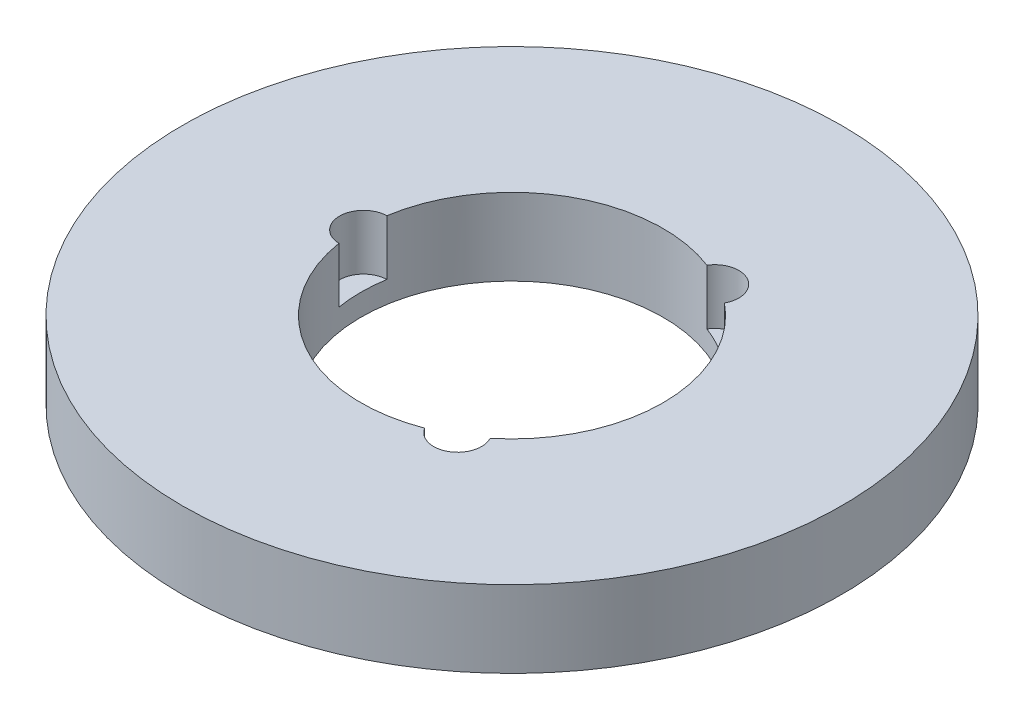
from build123d import *

# Parameters (mm, degrees)
SKETCH1_R           = 60
BOSS_EXTRUDE1_DEPTH = 14
SKETCH2_R           = 27.5
CUT_EXTRUDE1_DEPTH  = 87
SKETCH3_R           = 4.363101274
CUT_EXTRUDE2_DEPTH  = 10.056409431
CIRPATTERN1_COUNT   = 3


with BuildPart() as part:
    # Sketch1 → Boss-Extrude1 (new body)
    with BuildSketch(Plane(origin=(0, 0, 0), x_dir=(1, 0, 0), z_dir=(0, 1, 0))):
        Circle(SKETCH1_R)
    extrude(amount=BOSS_EXTRUDE1_DEPTH)

    # Sketch2 → Cut-Extrude1 (cut, through all)
    with BuildSketch(Plane(origin=(0, 0, 0), x_dir=(1, 0, 0), z_dir=(0, 1, 0))):
        Circle(SKETCH2_R)
    extrude(amount=CUT_EXTRUDE1_DEPTH, mode=Mode.SUBTRACT)

    # Sketch3 → Cut-Extrude2 (cut)
    with BuildSketch(Plane(origin=(0, 14, 0), x_dir=(1, 0, 0), z_dir=(0, 1, 0))):
        with Locations((-27.034279894, 0)):
            Circle(SKETCH3_R)
    cut_extrude2 = extrude(amount=-CUT_EXTRUDE2_DEPTH, mode=Mode.SUBTRACT)

    # CirPattern1: Cut-Extrude2 ×3 about axis
    cirpattern1_axis = Axis((0, 0, 0), (0, 1, 0))
    for i in range(1, CIRPATTERN1_COUNT):
        add(cut_extrude2.rotate(cirpattern1_axis, i * 360 / CIRPATTERN1_COUNT), mode=Mode.SUBTRACT)


solid = part.part
